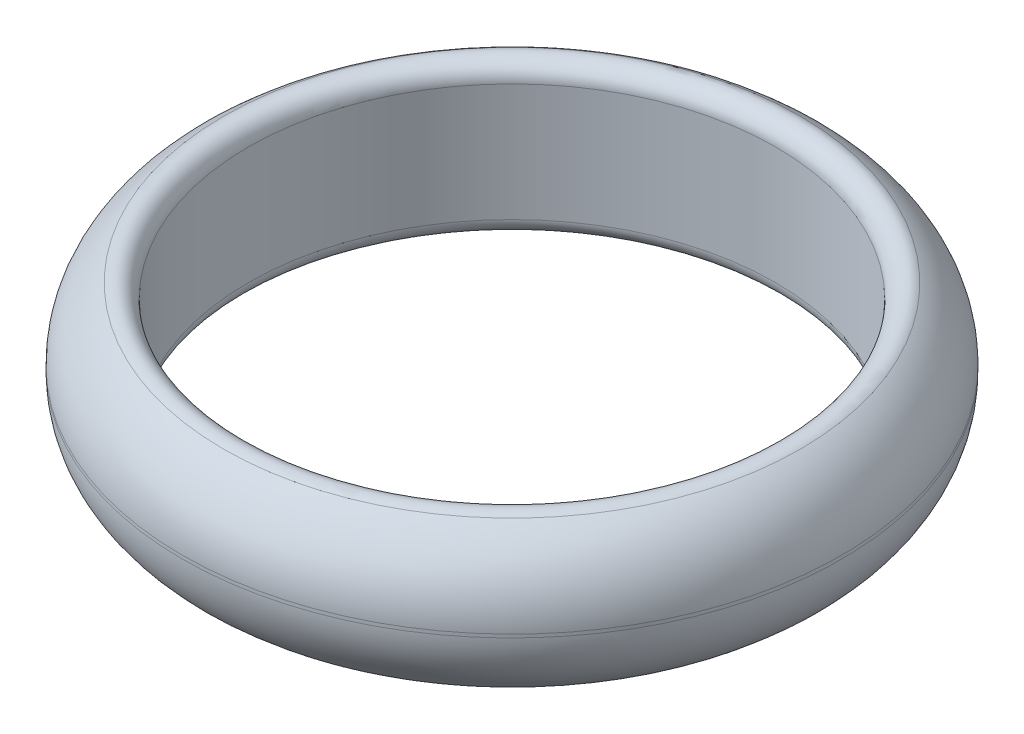
from build123d import *

# Parameters (mm, degrees)
SKETCH3_R           = 10
BOSS_EXTRUDE1_DEPTH = 5
SKETCH4_R           = 8
CUT_EXTRUDE1_DEPTH  = 5
FILLET2_R           = 2.5
FILLET5_R           = 0.5
FILLET6_R           = 0.5


with BuildPart() as part:
    # Sketch3 → Boss-Extrude1 (new body)
    with BuildSketch(Plane(origin=(0, 0, 0), x_dir=(1, 0, 0), z_dir=(0, 1, 0))):
        with Locations(Location((0, 0, 0), (0, 0, 270))):
            Circle(SKETCH3_R)
    extrude(amount=BOSS_EXTRUDE1_DEPTH)

    # Sketch4 → Cut-Extrude1 (cut)
    with BuildSketch(Plane(origin=(0, 5, 0), x_dir=(1, 0, 0), z_dir=(0, 1, 0))):
        with Locations(Location((0, 0, 0), (0, 0, 270))):
            Circle(SKETCH4_R)
    extrude(amount=-CUT_EXTRUDE1_DEPTH, mode=Mode.SUBTRACT)

    # Fillet2
    # the kernel refuses this fillet: 2.5 mm, written as the material it takes off along each edge
    with BuildSketch(Plane(origin=(0, 0, 0), x_dir=(0, 0, 1), z_dir=(-1, 0, 0))) as fillet2_piece_1:
        with BuildLine():
            CenterArc((7.5, 2.449489743), FILLET2_R, 281.536959033, 78.463040967)
            Line((8, 0), (8.01, -0.048989795))
            ThreePointArc((8.01, -0.048989795), (9, -0.05), (10, -0.05))
            Line((10, -0.05), (10.05, 0))
            Line((10.05, 0), (10.05, 2.449489743))
            Line((10.05, 2.449489743), (10, 2.449489743))
        make_face()
    revolve(axis=Axis((0, 0, 0), (0, 1, 0)), mode=Mode.SUBTRACT)
    with BuildSketch(Plane(origin=(0, 5, 0), x_dir=(0, 0, 1), z_dir=(-1, 0, 0))) as fillet2_piece_2:
        with BuildLine():
            CenterArc((7.5, -2.449489743), FILLET2_R, 0, 78.463040967)
            Line((8, 0), (8.01, 0.048989795))
            ThreePointArc((8.01, 0.048989795), (9, 0.05), (10, 0.05))
            Line((10, 0.05), (10.05, 0))
            Line((10.05, 0), (10.05, -2.449489743))
            Line((10.05, -2.449489743), (10, -2.449489743))
        make_face()
    revolve(axis=Axis((0, 5, 0), (0, 1, 0)), mode=Mode.SUBTRACT)

    # Fillet5
    fillet5_edges = [part.edges().sort_by_distance(p)[0] for p in [
        (0, 5, -8),
    ]]
    fillet(fillet5_edges, radius=FILLET5_R)

    # Fillet6
    fillet6_edges = [part.edges().sort_by_distance(p)[0] for p in [
        (0, 0, -8),
    ]]
    fillet(fillet6_edges, radius=FILLET6_R)


solid = part.part
